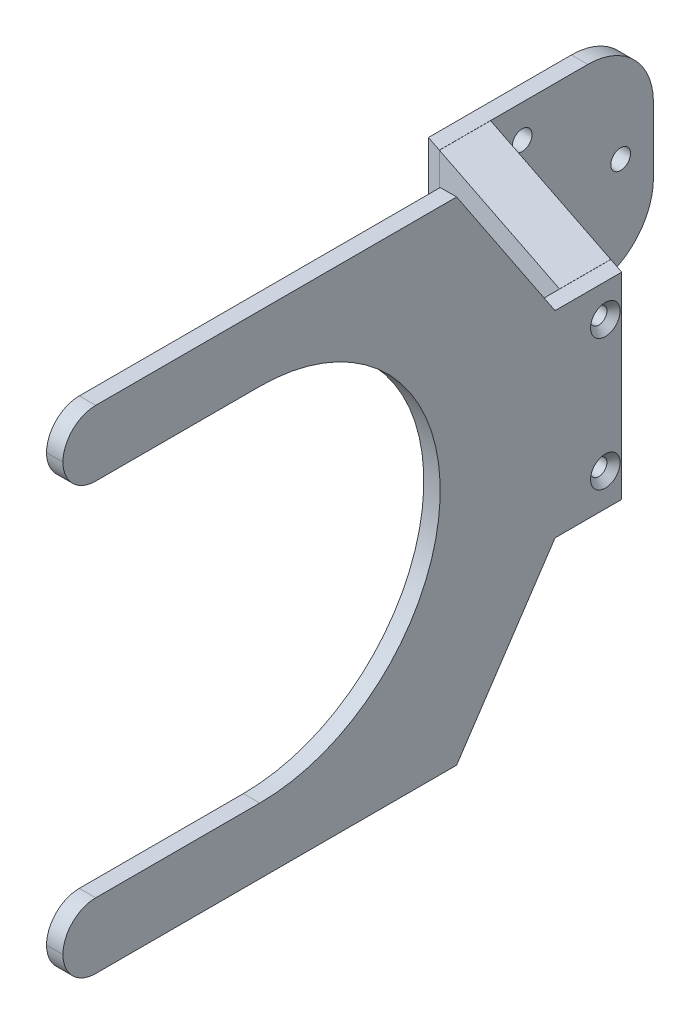
from build123d import *

# Parameters (mm, degrees)
BOSS_EXTRUDE1_DEPTH = 47.625
CUT_EXTRUDE1_DEPTH  = 165.916725198
FILLET1_R           = 6.35
FILLET2_R           = 12.7
CUT_EXTRUDE2_REACH  = 166.151
SKETCH3_R           = 1.905
BOSS_EXTRUDE2_DEPTH = 38.1
SKETCH6_W           = 0.0254
SKETCH6_H           = 12.687385225
SKETCH6_H_2         = 17.118946269
CUT_EXTRUDE3_DEPTH  = 171.65440406
SKETCH7_R           = 1.5875
CUT_EXTRUDE4_DEPTH  = 3.175
SKETCH8_R           = 1.27
CUT_EXTRUDE5_DEPTH  = 6.35
SKETCH9_R           = 1.5875
CUT_EXTRUDE6_DEPTH  = 3.175
SKETCH10_R          = 1.27
CUT_EXTRUDE7_DEPTH  = 6.35
CHAMFER1_SIZE       = 1.27
CHAMFER2_SIZE       = 1.27


with BuildPart() as part:
    # Sketch1 → Boss-Extrude1 (new, symmetric)
    with BuildSketch(Plane(origin=(0, 0, 0), x_dir=(1, 0, 0), z_dir=(0, 1, 0))):
        Polygon((0, 0), (0, -38.1), (38.1, -50.8), (38.1, -152.4), (34.925, -152.4), (34.925, -53.088410524), (-3.175, -40.388410524), (-3.175, 0), align=None)
    extrude(amount=BOSS_EXTRUDE1_DEPTH, both=True)

    # Sketch2 → Cut-Extrude1 (cut, through all)
    with BuildSketch(Plane(origin=(38.1, 0, 0), x_dir=(0, 0, -1), z_dir=(1, 0, 0))):
        with BuildLine():
            Line((-114.3, 34.925), (-152.4, 34.925))
            Line((-152.4, 34.925), (-152.4, -34.925))
            Line((-152.4, -34.925), (-114.3, -34.925))
            ThreePointArc((-114.3, -34.925), (-79.375, 0), (-114.3, 34.925))
        make_face()
        Polygon((0, 19.05), (-57.15, 19.05), (-76.2, 47.625), (0, 47.625), align=None)
        Polygon((0, -47.625), (0, -19.05), (-57.15, -19.05), (-76.2, -47.625), align=None)
    extrude(amount=-CUT_EXTRUDE1_DEPTH, mode=Mode.SUBTRACT)

    # Fillet1
    fillet1_edges = [part.edges().sort_by_distance(p)[0] for p in [
        (36.5125, -47.625, 152.4),
        (36.5125, -34.925, 152.4),
        (36.5125, 47.625, 152.4),
        (36.5125, 34.925, 152.4),
    ]]
    fillet(fillet1_edges, radius=FILLET1_R - 0.0001)  # a hair under: the kernel refuses the full size

    # Fillet2
    fillet2_edges = [part.edges().sort_by_distance(p)[0] for p in [
        (-1.5875, 19.05, 0),
        (-1.5875, -19.05, 0),
    ]]
    fillet(fillet2_edges, radius=FILLET2_R)

    # Sketch3 → Cut-Extrude2 (cut, up to next)
    with BuildSketch(Plane(origin=(0, 0, 0), x_dir=(0, 0, -1), z_dir=(1, 0, 0)), mode=Mode.PRIVATE) as cut_extrude2_sk1:
        with Locations((-25.4, 12.7)):
            Circle(SKETCH3_R)
    cut_extrude2_tool1 = extrude(cut_extrude2_sk1.sketch, amount=-CUT_EXTRUDE2_REACH, mode=Mode.PRIVATE) & part.part
    # Sketch3 → Cut-Extrude2 (cut, up to next)
    with BuildSketch(Plane(origin=(0, 0, 0), x_dir=(0, 0, -1), z_dir=(1, 0, 0)), mode=Mode.PRIVATE) as cut_extrude2_sk2:
        with Locations((-6.35, 0)):
            Circle(SKETCH3_R)
    cut_extrude2_tool2 = extrude(cut_extrude2_sk2.sketch, amount=-CUT_EXTRUDE2_REACH, mode=Mode.PRIVATE) & part.part
    # Sketch3 → Cut-Extrude2 (cut, up to next)
    with BuildSketch(Plane(origin=(0, 0, 0), x_dir=(0, 0, -1), z_dir=(1, 0, 0)), mode=Mode.PRIVATE) as cut_extrude2_sk3:
        with Locations((-25.4, -12.7)):
            Circle(SKETCH3_R)
    cut_extrude2_tool3 = extrude(cut_extrude2_sk3.sketch, amount=-CUT_EXTRUDE2_REACH, mode=Mode.PRIVATE) & part.part
    add(cut_extrude2_tool1.solids().sort_by_distance((0, 12.7, 25.4))[0], mode=Mode.SUBTRACT)
    add(cut_extrude2_tool2.solids().sort_by_distance((0, 0, 6.35))[0], mode=Mode.SUBTRACT)
    add(cut_extrude2_tool3.solids().sort_by_distance((0, -12.7, 25.4))[0], mode=Mode.SUBTRACT)

    # Sketch5 → Boss-Extrude2 (add)
    with BuildSketch(Plane(origin=(0, 19.05, 0), x_dir=(1, 0, 0), z_dir=(0, 1, 0))):
        Polygon((38.1, -50.8), (38.1, -44.24038204), (0, -31.54038204), (0, -38.1), align=None)
    extrude(amount=-BOSS_EXTRUDE2_DEPTH)

    # Sketch6 → Cut-Extrude3 (cut, through all)
    with BuildSketch(Plane(origin=(0, 19.05, 0), x_dir=(1, 0, 0), z_dir=(0, 1, 0))):
        with Locations((34.9123, -46.744717912)):
            Rectangle(SKETCH6_W, SKETCH6_H)
        with Locations((0.0127, -40.099855175)):
            Rectangle(SKETCH6_W, SKETCH6_H_2)
    extrude(amount=-CUT_EXTRUDE3_DEPTH, mode=Mode.SUBTRACT)


with BuildPart() as cut_extrude3_piece_1:
    # of the separate pieces the step leaves, piece 1, a body of its own (cut_extrude3_pieces)
    add(part.part.solids().sort_by_distance((38.1, 19.05, 44.24038204))[0])

    # Sketch7 → Cut-Extrude4 (cut)
    with BuildSketch(Plane(origin=(38.1, 0, 0), x_dir=(0, 0, -1), z_dir=(1, 0, 0))):
        with Locations((-47.41538204, 12.7)):
            Circle(SKETCH7_R)
        with Locations((-47.41538204, -12.7)):
            Circle(SKETCH7_R)
    extrude(amount=-CUT_EXTRUDE4_DEPTH, mode=Mode.SUBTRACT)

    # Chamfer1
    chamfer1_edges = [cut_extrude3_piece_1.edges().sort_by_distance(p)[0] for p in [
        (38.1, 12.7, 49.00288204),
        (38.1, -12.7, 49.00288204),
    ]]
    chamfer(chamfer1_edges, length=CHAMFER1_SIZE)


with BuildPart() as cut_extrude3_piece_2:
    # of the separate pieces the step leaves, piece 2, a body of its own (cut_extrude3_pieces)
    add(part.part.solids().sort_by_distance((34.8996, 19.05, 43.17358204))[0])

    # Sketch8 → Cut-Extrude5 (cut)
    with BuildSketch(Plane(origin=(34.8996, 0, 0), x_dir=(0, 0, -1), z_dir=(1, 0, 0))):
        with Locations(Location((-47.41538204, 12.7, 0), (0, 0, 90))):
            Circle(SKETCH8_R)
        with Locations(Location((-47.41538204, -12.7, 0), (0, 0, 90))):
            Circle(SKETCH8_R)
    extrude(amount=-CUT_EXTRUDE5_DEPTH, mode=Mode.SUBTRACT)

    # Sketch10 → Cut-Extrude7 (cut)
    with BuildSketch(Plane.ZY.offset(-0.0254)):
        with Locations((37.213410524, 12.7)):
            Circle(SKETCH10_R)
        with Locations((37.213410524, -12.7)):
            Circle(SKETCH10_R)
    extrude(amount=-CUT_EXTRUDE7_DEPTH, mode=Mode.SUBTRACT)


with BuildPart() as cut_extrude3_piece_3:
    # of the separate pieces the step leaves, piece 3, a body of its own (cut_extrude3_pieces)
    add(part.part.solids().sort_by_distance((0, 19.05, 41.446743857))[0])

    # Sketch9 → Cut-Extrude6 (cut)
    with BuildSketch(Plane.ZY.offset(3.175)):
        with Locations((37.213410524, 12.7)):
            Circle(SKETCH9_R)
        with Locations((37.213410524, -12.7)):
            Circle(SKETCH9_R)
    extrude(amount=-CUT_EXTRUDE6_DEPTH, mode=Mode.SUBTRACT)

    # Chamfer2
    chamfer2_edges = [cut_extrude3_piece_3.edges().sort_by_distance(p)[0] for p in [
        (-3.175, 12.7, 35.625910524),
        (-3.175, -12.7, 35.625910524),
    ]]
    chamfer(chamfer2_edges, length=CHAMFER2_SIZE)


solid = Compound([cut_extrude3_piece_1.part, cut_extrude3_piece_2.part, cut_extrude3_piece_3.part])
